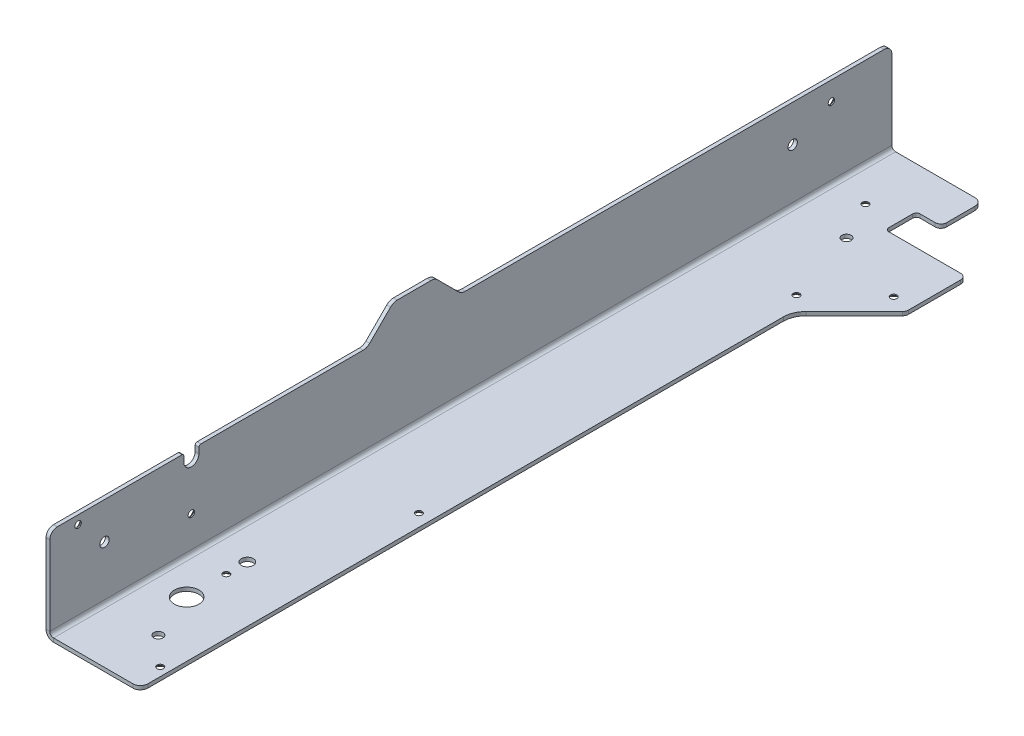
from build123d import *

# Parameters (mm, degrees)
BOSS_EXTRUDE1_DEPTH                            = 2
F_6_3_6_3_DIAMETER_HOLE1_D                     = 6.3
HOLE1_D                                        = 4.917
F_13_0_13_DIAMETER_HOLE1_D                     = 13
CSK_FOR_M3_FLAT_HEAD_MACHINE_SCREW1_AT_2_COUNT = 2
CSK_FOR_M3_FLAT_HEAD_MACHINE_SCREW1_AT_2_PITCH = 339.560377547
CSK_FOR_M3_FLAT_HEAD_MACHINE_SCREW1_AT_3_COUNT = 2
CSK_FOR_M3_FLAT_HEAD_MACHINE_SCREW1_AT_3_PITCH = 37.712388981
CSK_FOR_M3_FLAT_HEAD_MACHINE_SCREW1_AT_4_COUNT = 2
CSK_FOR_M3_FLAT_HEAD_MACHINE_SCREW1_AT_4_PITCH = 99.634302204
CSK_FOR_M3_FLAT_HEAD_MACHINE_SCREW1_AT_5_COUNT = 2
CSK_FOR_M3_FLAT_HEAD_MACHINE_SCREW1_AT_5_PITCH = 285.529322795
CSK_FOR_M3_FLAT_HEAD_MACHINE_SCREW1_AT_6_COUNT = 2
CSK_FOR_M3_FLAT_HEAD_MACHINE_SCREW1_AT_6_PITCH = 316.26255041
CSK_FOR_M3_FLAT_HEAD_MACHINE_SCREW1_AT_7_COUNT = 2
CSK_FOR_M3_FLAT_HEAD_MACHINE_SCREW1_AT_7_PITCH = 341.036305829
CSK_FOR_M3_FLAT_HEAD_MACHINE_SCREW1_AT_8_COUNT = 2
CSK_FOR_M3_FLAT_HEAD_MACHINE_SCREW1_AT_8_PITCH = 86.791956607
CSK_FOR_M3_FLAT_HEAD_MACHINE_SCREW1_AT_9_COUNT = 2
CSK_FOR_M3_FLAT_HEAD_MACHINE_SCREW1_AT_9_PITCH = 65
SKETCHED_START                                 = -60.712388981
SKETCHED_BEND1_OUTLINE_W                       = 2
SKETCHED_BEND1_OUTLINE_H                       = 446.00000001
SKETCHED_BEND1_DEPTH                           = 61.123348981
SKETCHED_START_2                               = 1.400733568
SKETCHED_BEND1_2_OUTLINE_R                     = 2.4585
SKETCHED_BEND1_2_OUTLINE_R_2                   = 1.7
SKETCHED_BEND1_2_DEPTH                         = 0.599266432
SKETCHED_BEND1_3_OUTLINE_R                     = 2.4585
SKETCHED_BEND1_3_OUTLINE_R_2                   = 1.7
SKETCHED_BEND1_3_DEPTH                         = 4
SKETCHED_START_3                               = -224
SKETCHED_BEND1_4_DEPTH                         = 448


with BuildPart() as part:
    # Sketch5 → Boss-Extrude1 (new body)
    with BuildSketch(Plane.XZ):
        with BuildLine():
            Line((50.000000006, -117.529437252), (50.000000006, 219.000000006))
            ThreePointArc((50.000000006, 219.000000006), (48.82842713, 221.828427132), (46.000000004, 223.000000008))
            Line((46.000000004, 223.000000008), (-42.712388976, 223.000000008))
            ThreePointArc((-42.712388976, 223.000000008), (-45.540816105, 221.828427131), (-46.712388981, 219.000000003))
            Line((-46.712388981, 219.000000003), (-46.712388981, 153.000000003))
            ThreePointArc((-46.712388981, 153.000000003), (-46.419495765, 152.292893227), (-45.712388989, 152.00000001))
            Line((-45.712388989, 152.00000001), (-42.712388991, 152.00000001))
            ThreePointArc((-42.712388991, 152.00000001), (-38.712388981, 148), (-42.712388991, 143.99999999))
            Line((-42.712388991, 143.99999999), (-45.712388994, 143.99999999))
            ThreePointArc((-45.712388994, 143.99999999), (-46.419495766, 143.707106775), (-46.712388981, 143.000000003))
            Line((-46.712388981, 143.000000003), (-46.712388981, 57.071067809))
            ThreePointArc((-46.712388981, 57.071067809), (-47.092991321, 55.157650638), (-48.176855083, 53.535533886))
            Line((-48.176855083, 53.535533886), (-59.247922895, 42.464466074))
            ThreePointArc((-59.247922895, 42.464466074), (-60.331786645, 40.842349339), (-60.712388981, 38.928932188))
            Line((-60.712388981, 38.928932188), (-60.712388981, 21.071067812))
            ThreePointArc((-60.712388981, 21.071067812), (-60.331786645, 19.157650661), (-59.247922895, 17.535533927))
            Line((-59.247922895, 17.535533927), (-48.176855083, 6.464466115))
            ThreePointArc((-48.176855083, 6.464466115), (-47.092991321, 4.842349362), (-46.712388981, 2.928932191))
            Line((-46.712388981, 2.928932191), (-46.712388981, -218.999999997))
            ThreePointArc((-46.712388981, -218.999999997), (-45.540816105, -221.828427126), (-42.712388976, -223.000000002))
            Line((-42.712388976, -223.000000002), (46.000000004, -223.000000002))
            ThreePointArc((46.000000004, -223.000000002), (48.82842713, -221.828427127), (50.000000006, -219))
            Line((50.000000006, -219), (50.000000006, -204))
            ThreePointArc((50.000000006, -204), (49.121320358, -201.878679676), (47.000000033, -201.000000027))
            Line((47.000000033, -201.000000027), (39.000000033, -201.000000027))
            ThreePointArc((39.000000033, -201.000000027), (37.585786446, -200.41421358), (36.999999998, -198.999999992))
            Line((36.999999998, -198.999999992), (36.999999998, -186.499999992))
            ThreePointArc((36.999999998, -186.499999992), (37.585786439, -185.085786422), (39.000000009, -184.499999981))
            Line((39.000000009, -184.499999981), (77.000000009, -184.499999981))
            ThreePointArc((77.000000009, -184.499999981), (79.121320349, -183.621320326), (80.000000004, -181.499999986))
            Line((80.000000004, -181.499999986), (80.000000004, -153.742640692))
            ThreePointArc((80.000000004, -153.742640692), (79.771638599, -152.594590381), (79.121320338, -151.621320324))
            Line((79.121320338, -151.621320324), (53.514718626, -126.014718612))
            ThreePointArc((53.514718626, -126.014718612), (50.913445614, -122.121638433), (50.000000006, -117.529437252))
        make_face()
    extrude(amount=-BOSS_EXTRUDE1_DEPTH)

    # Ø6.3 (6.3) Diameter Hole1 (through all)
    with Locations(Plane(origin=(0, 0, 0), x_dir=(-1, 0, 0), z_dir=(0, -1, 0))):
        with Locations((-20.5, -136.85)):
            Hole(F_6_3_6_3_DIAMETER_HOLE1_D / 2)

    # Hole1 (through all)
    with Locations(Plane(origin=(0, 2, 0), x_dir=(1, 0, 0), z_dir=(0, 1, 0))):
        with Locations((30.5, 170.5), (30.5, -194), (-27.212388981, -194), (-27.212388981, 170.5)):
            Hole(HOLE1_D / 2)

    # Ø13.0 (13) Diameter Hole1 (through all)
    with Locations(Plane(origin=(0, 2, 0), x_dir=(1, 0, 0), z_dir=(0, 1, 0))):
        with Locations((20.5, -169)):
            Hole(F_13_0_13_DIAMETER_HOLE1_D / 2)

    # Sketch12 → CSK for M3 Flat Head Machine Screw1 (revolve, cut)
    with BuildSketch(Plane(origin=(-17.212388981, 0, 148), x_dir=(0, 0, -1), z_dir=(1, 0, 0))):
        Polygon((0, 0), (0, 2), (1.7, 2), (1.7, 1.450000001), (3.149999999, 0), align=None)
    csk_for_m3_flat_head_machine_screw1 = revolve(axis=Axis((-17.212388981, -6.35, 148), (0, 1, 0)), mode=Mode.SUBTRACT)

    # CSK for M3 Flat Head Machine Screw1 at 2: CSK for M3 Flat Head Machine Screw1 ×2
    with Locations(*[Vector(-0.0574271949538317, 0, -0.9983496968896894) * (i * CSK_FOR_M3_FLAT_HEAD_MACHINE_SCREW1_AT_2_PITCH) for i in range(1, CSK_FOR_M3_FLAT_HEAD_MACHINE_SCREW1_AT_2_COUNT)]):
        add(csk_for_m3_flat_head_machine_screw1, mode=Mode.SUBTRACT)

    # CSK for M3 Flat Head Machine Screw1 at 3: CSK for M3 Flat Head Machine Screw1 ×2
    with Locations(*[(i * CSK_FOR_M3_FLAT_HEAD_MACHINE_SCREW1_AT_3_PITCH, 0, 0) for i in range(1, CSK_FOR_M3_FLAT_HEAD_MACHINE_SCREW1_AT_3_COUNT)]):
        add(csk_for_m3_flat_head_machine_screw1, mode=Mode.SUBTRACT)

    # CSK for M3 Flat Head Machine Screw1 at 4: CSK for M3 Flat Head Machine Screw1 ×2
    with Locations(*[Vector(0.6093522776533882, 0, -0.7928996164197761) * (i * CSK_FOR_M3_FLAT_HEAD_MACHINE_SCREW1_AT_4_PITCH) for i in range(1, CSK_FOR_M3_FLAT_HEAD_MACHINE_SCREW1_AT_4_COUNT)]):
        add(csk_for_m3_flat_head_machine_screw1, mode=Mode.SUBTRACT)

    # CSK for M3 Flat Head Machine Screw1 at 5: CSK for M3 Flat Head Machine Screw1 ×2
    with Locations(*[Vector(0.21263101241678778, 0, -0.9771325665223792) * (i * CSK_FOR_M3_FLAT_HEAD_MACHINE_SCREW1_AT_5_PITCH) for i in range(1, CSK_FOR_M3_FLAT_HEAD_MACHINE_SCREW1_AT_5_COUNT)]):
        add(csk_for_m3_flat_head_machine_screw1, mode=Mode.SUBTRACT)

    # CSK for M3 Flat Head Machine Screw1 at 6: CSK for M3 Flat Head Machine Screw1 ×2
    with Locations(*[Vector(0.2757594563996407, 0, -0.9612266757670507) * (i * CSK_FOR_M3_FLAT_HEAD_MACHINE_SCREW1_AT_6_PITCH) for i in range(1, CSK_FOR_M3_FLAT_HEAD_MACHINE_SCREW1_AT_6_COUNT)]):
        add(csk_for_m3_flat_head_machine_screw1, mode=Mode.SUBTRACT)

    # CSK for M3 Flat Head Machine Screw1 at 7: CSK for M3 Flat Head Machine Screw1 ×2
    with Locations(*[Vector(0.10911562301287396, 0, -0.994029064371114) * (i * CSK_FOR_M3_FLAT_HEAD_MACHINE_SCREW1_AT_7_PITCH) for i in range(1, CSK_FOR_M3_FLAT_HEAD_MACHINE_SCREW1_AT_7_COUNT)]):
        add(csk_for_m3_flat_head_machine_screw1, mode=Mode.SUBTRACT)

    # CSK for M3 Flat Head Machine Screw1 at 8: CSK for M3 Flat Head Machine Screw1 ×2
    with Locations(*[Vector(0.7225599172123858, 0, 0.6913083002814522) * (i * CSK_FOR_M3_FLAT_HEAD_MACHINE_SCREW1_AT_8_PITCH) for i in range(1, CSK_FOR_M3_FLAT_HEAD_MACHINE_SCREW1_AT_8_COUNT)]):
        add(csk_for_m3_flat_head_machine_screw1, mode=Mode.SUBTRACT)

    # CSK for M3 Flat Head Machine Screw1 at 9: CSK for M3 Flat Head Machine Screw1 ×2
    with Locations(*[Vector(-0.3846153846153844, 0, 0.9230769230769231) * (i * CSK_FOR_M3_FLAT_HEAD_MACHINE_SCREW1_AT_9_PITCH) for i in range(1, CSK_FOR_M3_FLAT_HEAD_MACHINE_SCREW1_AT_9_COUNT)]):
        add(csk_for_m3_flat_head_machine_screw1, mode=Mode.SUBTRACT)

    # Sketched Bend1: read off the stored shape, not the designer's step
    # Sketched Bend1 outline → Sketched Bend1 (cut)
    with BuildSketch(Plane.YZ.offset(SKETCHED_START)):
        with Locations((1, 3e-09)):
            Rectangle(SKETCHED_BEND1_OUTLINE_W, SKETCHED_BEND1_OUTLINE_H)
    extrude(amount=SKETCHED_BEND1_DEPTH, mode=Mode.SUBTRACT)

    # Sketched Bend1 2 outline → Sketched Bend1 2 (add)
    with BuildSketch(Plane.YZ.offset(SKETCHED_START_2)):
        with BuildLine():
            Line((2, -223.000000002), (45.999999996, -223.000000002))
            ThreePointArc((45.999999996, -223.000000002), (48.828427124, -221.828427126), (50.000000001, -218.999999997))
            Line((50.000000001, -218.999999997), (50.000000001, 2.928932191))
            ThreePointArc((50.000000001, 2.928932191), (50.38060234, 4.842349363), (51.464466103, 6.464466115))
            Line((51.464466103, 6.464466115), (62.535533915, 17.535533927))
            ThreePointArc((62.535533915, 17.535533927), (63.619397665, 19.157650661), (64, 21.071067812))
            Line((64, 21.071067812), (64, 38.928932188))
            ThreePointArc((64, 38.928932188), (63.619397665, 40.842349339), (62.535533914, 42.464466074))
            Line((62.535533914, 42.464466074), (51.464466102, 53.535533886))
            ThreePointArc((51.464466102, 53.535533886), (50.38060234, 55.157650638), (50.000000001, 57.071067809))
            Line((50.000000001, 57.071067809), (50.000000001, 143.000000003))
            ThreePointArc((50.000000001, 143.000000003), (49.707106786, 143.707106775), (49.000000014, 143.99999999))
            Line((49.000000014, 143.99999999), (46.000000011, 143.99999999))
            ThreePointArc((46.000000011, 143.99999999), (42.000000001, 148), (46.000000011, 152.00000001))
            Line((46.000000011, 152.00000001), (49.000000009, 152.00000001))
            ThreePointArc((49.000000009, 152.00000001), (49.707106784, 152.292893227), (50.000000001, 153.000000003))
            Line((50.000000001, 153.000000003), (50.000000001, 219.000000003))
            ThreePointArc((50.000000001, 219.000000003), (48.828427124, 221.828427131), (45.999999996, 223.000000008))
            Line((45.999999996, 223.000000008), (2, 223.000000008))
            Line((2, 223.000000008), (2, -223.000000002))
        make_face()
        with Locations((30.5, -170.5)):
            Circle(SKETCHED_BEND1_2_OUTLINE_R, mode=Mode.SUBTRACT)
        with Locations((40, -191)):
            Circle(SKETCHED_BEND1_2_OUTLINE_R_2, mode=Mode.SUBTRACT)
        with Locations((20.5, 148)):
            Circle(SKETCHED_BEND1_2_OUTLINE_R_2, mode=Mode.SUBTRACT)
        with Locations((30.5, 194)):
            Circle(SKETCHED_BEND1_2_OUTLINE_R, mode=Mode.SUBTRACT)
        with Locations((45.5, 208)):
            Circle(SKETCHED_BEND1_2_OUTLINE_R_2, mode=Mode.SUBTRACT)
    extrude(amount=SKETCHED_BEND1_2_DEPTH)

    # Sketched Bend1 3 outline → Sketched Bend1 3 (add)
    with BuildSketch(Plane.YZ):
        with BuildLine():
            Line((2, -223.000000002), (45.999999996, -223.000000002))
            ThreePointArc((45.999999996, -223.000000002), (48.828427124, -221.828427126), (50.000000001, -218.999999997))
            Line((50.000000001, -218.999999997), (50.000000001, 2.928932191))
            ThreePointArc((50.000000001, 2.928932191), (50.38060234, 4.842349363), (51.464466103, 6.464466115))
            Line((51.464466103, 6.464466115), (62.535533915, 17.535533927))
            ThreePointArc((62.535533915, 17.535533927), (63.619397665, 19.157650661), (64, 21.071067812))
            Line((64, 21.071067812), (64, 38.928932188))
            ThreePointArc((64, 38.928932188), (63.619397665, 40.842349339), (62.535533914, 42.464466074))
            Line((62.535533914, 42.464466074), (51.464466102, 53.535533886))
            ThreePointArc((51.464466102, 53.535533886), (50.38060234, 55.157650638), (50.000000001, 57.071067809))
            Line((50.000000001, 57.071067809), (50.000000001, 143.000000003))
            ThreePointArc((50.000000001, 143.000000003), (49.707106786, 143.707106775), (49.000000014, 143.99999999))
            Line((49.000000014, 143.99999999), (46.000000011, 143.99999999))
            ThreePointArc((46.000000011, 143.99999999), (42.000000001, 148), (46.000000011, 152.00000001))
            Line((46.000000011, 152.00000001), (49.000000009, 152.00000001))
            ThreePointArc((49.000000009, 152.00000001), (49.707106784, 152.292893227), (50.000000001, 153.000000003))
            Line((50.000000001, 153.000000003), (50.000000001, 219.000000003))
            ThreePointArc((50.000000001, 219.000000003), (48.828427124, 221.828427131), (45.999999996, 223.000000008))
            Line((45.999999996, 223.000000008), (2, 223.000000008))
            Line((2, 223.000000008), (2, -223.000000002))
        make_face()
        with Locations((30.5, -170.5)):
            Circle(SKETCHED_BEND1_3_OUTLINE_R, mode=Mode.SUBTRACT)
        with Locations((40, -191)):
            Circle(SKETCHED_BEND1_3_OUTLINE_R_2, mode=Mode.SUBTRACT)
        with Locations((20.5, 148)):
            Circle(SKETCHED_BEND1_3_OUTLINE_R_2, mode=Mode.SUBTRACT)
        with Locations((30.5, 194)):
            Circle(SKETCHED_BEND1_3_OUTLINE_R, mode=Mode.SUBTRACT)
        with Locations((45.5, 208)):
            Circle(SKETCHED_BEND1_3_OUTLINE_R_2, mode=Mode.SUBTRACT)
    extrude(amount=SKETCHED_BEND1_3_DEPTH)

    # Sketched Bend1 4 outline → Sketched Bend1 4 (cut)
    with BuildSketch(Plane.XY.offset(SKETCHED_START_3)):
        with BuildLine():
            ThreePointArc((4, 0), (1.171572875, 1.171572875), (0, 4))
            Line((0, 4), (0, 2))
            Line((0, 2), (0.41096, 2))
            Line((0.41096, 2), (0.41096, 0))
            Line((0.41096, 0), (4, 0))
        make_face()
        with BuildLine():
            ThreePointArc((2, 4), (2.585786438, 2.585786438), (4, 2))
            Line((4, 2), (4, 64))
            Line((4, 64), (2, 64))
            Line((2, 64), (2, 4))
        make_face()
    extrude(amount=SKETCHED_BEND1_4_DEPTH, mode=Mode.SUBTRACT)

    # Sketched Bend1 5 outline → Sketched Bend1 5 (revolve, cut)
    with BuildSketch(Plane(origin=(0, 45.5, 208), x_dir=(0, 1, 0), z_dir=(0, 0, -1))):
        Polygon((3.149999999, 0), (1.7, 1.450000001), (1.7, 0), align=None)
    revolve(axis=Axis((0, 45.5, 208), (1, 0, 0)), mode=Mode.SUBTRACT)

    # Sketched Bend1 6 outline → Sketched Bend1 6 (revolve, cut)
    with BuildSketch(Plane(origin=(0, 40, -191), x_dir=(0, 1, 0), z_dir=(0, 0, -1))):
        Polygon((3.149999999, 0), (1.7, 1.450000001), (1.7, 0), align=None)
    revolve(axis=Axis((0, 40, -191), (1, 0, 0)), mode=Mode.SUBTRACT)

    # Sketched Bend1 7 outline → Sketched Bend1 7 (revolve, cut)
    with BuildSketch(Plane(origin=(0, 20.5, 148), x_dir=(0, 1, 0), z_dir=(0, 0, -1))):
        Polygon((3.149999999, 0), (1.7, 1.450000001), (1.7, 0), align=None)
    revolve(axis=Axis((0, 20.5, 148), (1, 0, 0)), mode=Mode.SUBTRACT)


solid = part.part
